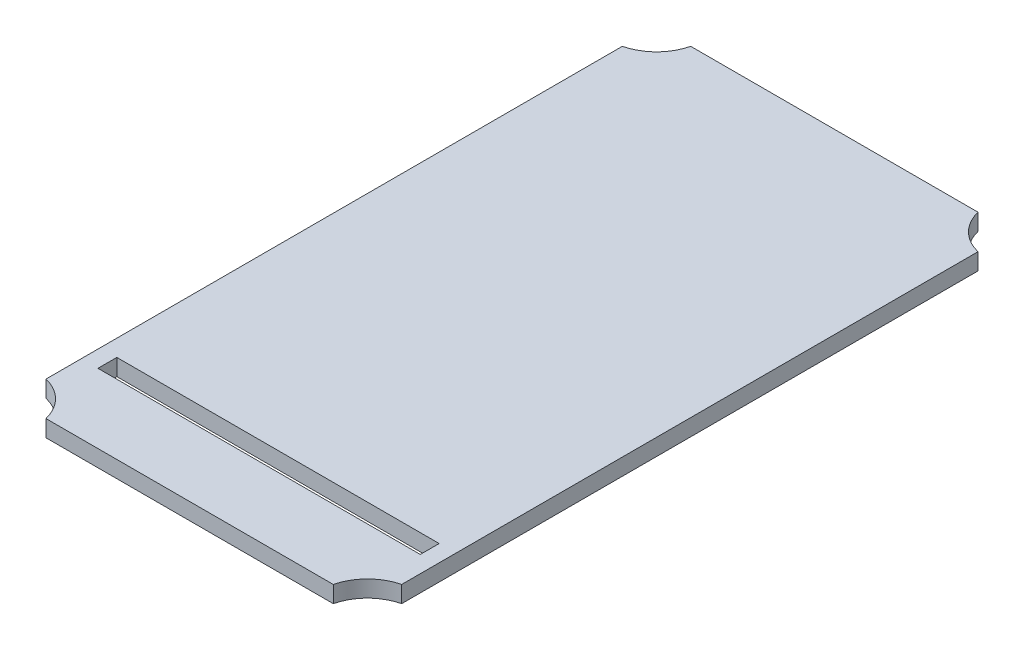
from build123d import *

# Parameters (mm, degrees)
SKETCH1_W           = 34
SKETCH1_H           = 60
BOSS_EXTRUDE1_DEPTH = 1.5
CUT_EXTRUDE2_DEPTH  = 1.5
SKETCH6_OUTSIDE_W   = 49.796
SKETCH6_OUTSIDE_H   = 75.796
SKETCH6_OUTSIDE_W_2 = 32
SKETCH6_OUTSIDE_H_2 = 58
CUT_EXTRUDE3_DEPTH  = 1.5
SKETCH7_W           = 29
SKETCH7_H           = 1.7
CUT_EXTRUDE4_DEPTH  = 10


with BuildPart() as part:
    # Sketch1 → Boss-Extrude1 (new body)
    with BuildSketch(Plane(origin=(0, 0, 0), x_dir=(1, 0, 0), z_dir=(0, 1, 0))):
        Rectangle(SKETCH1_W, SKETCH1_H)
    extrude(amount=BOSS_EXTRUDE1_DEPTH)

    # Sketch5 → Cut-Extrude2 (cut)
    with BuildSketch(Plane(origin=(0, 1.5, 0), x_dir=(1, 0, 0), z_dir=(0, 1, 0))):
        with BuildLine():
            Line((-17, 25.8), (-17, 30))
            Line((-17, 30), (-12.8, 30))
            ThreePointArc((-12.8, 30), (-14.030151519, 27.030151519), (-17, 25.8))
        make_face()
        with BuildLine():
            Line((17, 30), (12.8, 30))
            ThreePointArc((12.8, 30), (14.030151519, 27.030151519), (17, 25.8))
            Line((17, 25.8), (17, 30))
        make_face()
        with BuildLine():
            Line((17, -25.8), (17, -30))
            Line((17, -30), (12.8, -30))
            ThreePointArc((12.8, -30), (14.030151519, -27.030151519), (17, -25.8))
        make_face()
        with BuildLine():
            Line((-17, -30), (-12.8, -30))
            ThreePointArc((-12.8, -30), (-14.030151519, -27.030151519), (-17, -25.8))
            Line((-17, -25.8), (-17, -30))
        make_face()
    extrude(amount=-CUT_EXTRUDE2_DEPTH, mode=Mode.SUBTRACT)

    # Sketch6 outside → Cut-Extrude3 (cut)
    with BuildSketch(Plane(origin=(0, 1.5, 0), x_dir=(1, 0, 0), z_dir=(0, 1, 0))):
        Rectangle(SKETCH6_OUTSIDE_W, SKETCH6_OUTSIDE_H)
        Rectangle(SKETCH6_OUTSIDE_W_2, SKETCH6_OUTSIDE_H_2, mode=Mode.SUBTRACT)
    extrude(amount=-CUT_EXTRUDE3_DEPTH, mode=Mode.SUBTRACT)

    # Sketch7 → Cut-Extrude4 (cut)
    with BuildSketch(Plane(origin=(0, 1.5, 0), x_dir=(1, 0, 0), z_dir=(0, 1, 0))):
        with Locations((0, -21.9)):
            Rectangle(SKETCH7_W, SKETCH7_H)
    extrude(amount=-CUT_EXTRUDE4_DEPTH, mode=Mode.SUBTRACT)


solid = part.part
